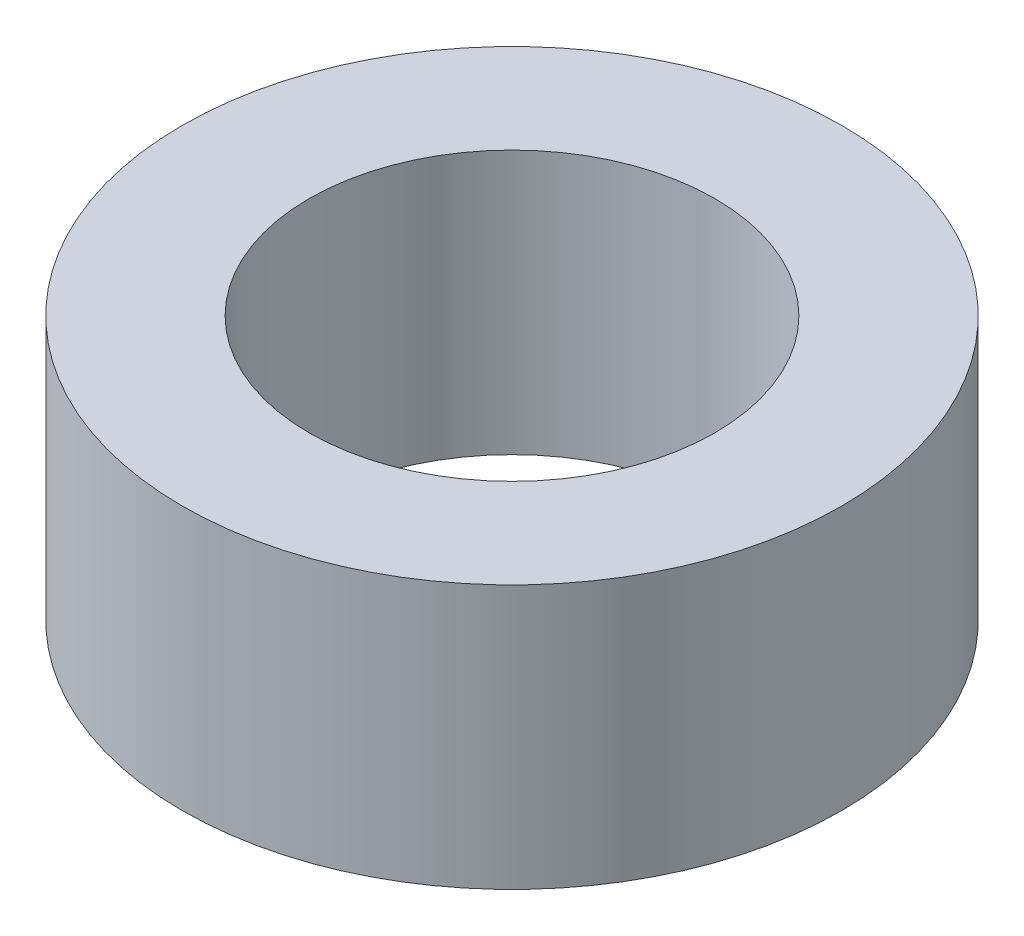
from build123d import *

# Parameters (mm, degrees)
SKETCH1_R           = 32.5
BOSS_EXTRUDE1_DEPTH = 26
SKETCH2_R           = 20
CUT_EXTRUDE1_DEPTH  = 53.80624963


with BuildPart() as part:
    # Sketch1 → Boss-Extrude1 (new body)
    with BuildSketch(Plane(origin=(0, 0, 0), x_dir=(1, 0, 0), z_dir=(0, 1, 0))):
        Circle(SKETCH1_R)
    extrude(amount=BOSS_EXTRUDE1_DEPTH)

    # Sketch2 → Cut-Extrude1 (cut, through all)
    with BuildSketch(Plane(origin=(0, 0, 0), x_dir=(1, 0, 0), z_dir=(0, 1, 0))):
        Circle(SKETCH2_R)
    extrude(amount=CUT_EXTRUDE1_DEPTH, mode=Mode.SUBTRACT)


solid = part.part
